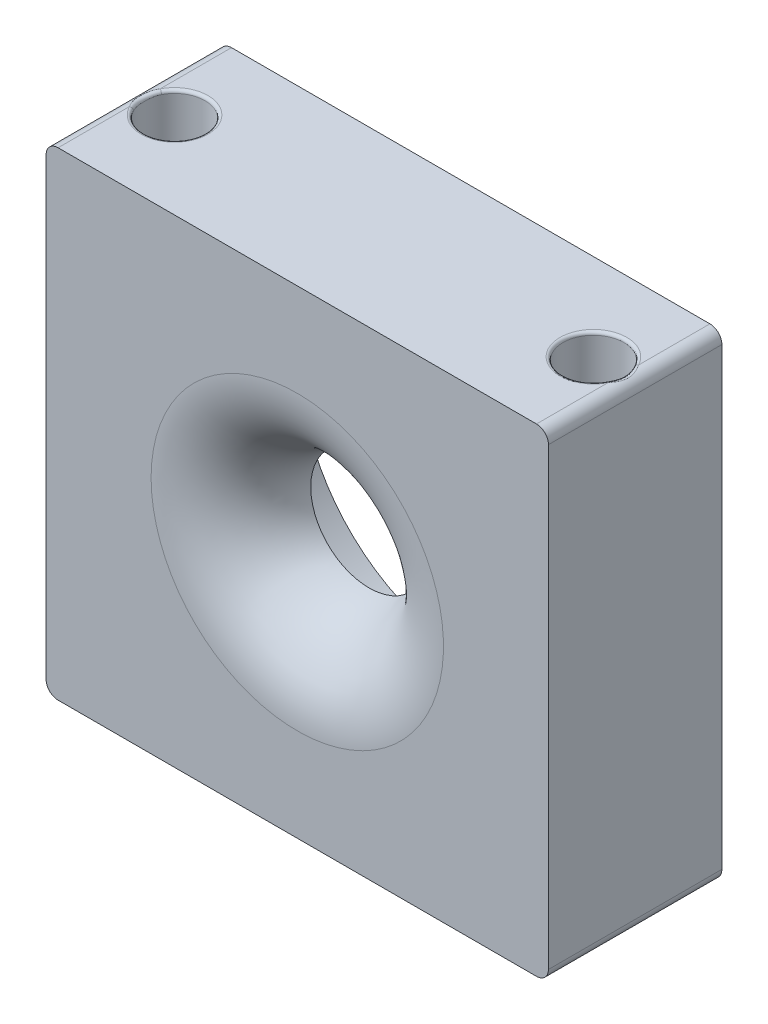
from build123d import *

# Parameters (mm, degrees)
SKETCH1_W          = 80
SKETCH1_H          = 84
SKETCH1_R          = 9.75
MAIN_BOSS_DEPTH    = 29
SKETCH2_R          = 28.5
CUT_EXTRUDE1_DEPTH = 17
FILLET1_R          = 15
SKETCH3_R          = 5.1
SCREW_HEAD_DEPTH   = 38
NUT_START          = -42
NUT_SLOT_DEPTH     = 4.8
SKETCH5_R          = 3.2
THROUGH_HOLE_DEPTH = 62
FILLET2_R          = 3
FILLET3_R          = 2
FILLET4_R          = 0.5


with BuildPart() as part:
    # Sketch1 → Main Boss (new body)
    with BuildSketch(Plane(origin=(0, 0, 0), x_dir=(0, 1, 0), z_dir=(0, 0, 1))):
        Rectangle(SKETCH1_W, SKETCH1_H)
        with Locations(Location((0, 0, 0), (0, 0, 90))):
            Circle(SKETCH1_R, mode=Mode.SUBTRACT)
    extrude(amount=MAIN_BOSS_DEPTH)

    # Sketch2 → Cut-Extrude1 (cut)
    with BuildSketch(Plane(origin=(0, 0, 0), x_dir=(1, 0, 0), z_dir=(0, 0, -1))):
        with Locations(Location((0, 0, 0), (0, 0, 180))):
            Circle(SKETCH2_R)
    extrude(amount=-CUT_EXTRUDE1_DEPTH, mode=Mode.SUBTRACT)

    # Fillet1
    # the kernel refuses this fillet: 15 mm, written as the material it takes off along each edge
    with BuildSketch(Plane(origin=(0, 0, 29), x_dir=(-1, 0, 0), z_dir=(0, 1, 0))) as fillet1_piece_1:
        with BuildLine():
            CenterArc((24.446938457, -15), FILLET1_R, 90, 78.463040967)
            Line((9.75, -12), (9.456061231, -11.94))
            ThreePointArc((9.456061231, -11.94), (9.45, -6), (9.45, 0))
            Line((9.45, 0), (9.75, 0.3))
            Line((9.75, 0.3), (24.446938457, 0.3))
            Line((24.446938457, 0.3), (24.446938457, 0))
        make_face()
    revolve(axis=Axis((0, 0, 29), (0, 0, 1)), mode=Mode.SUBTRACT)

    # Sketch3 → Screw Head (cut)
    with BuildSketch(Plane(origin=(0, 40, 0), x_dir=(-1, 0, 0), z_dir=(0, 1, 0))):
        with Locations((-35.025, 14.5)):
            Circle(SKETCH3_R)
        with Locations((35.025, 14.5)):
            Circle(SKETCH3_R)
    extrude(amount=-SCREW_HEAD_DEPTH, mode=Mode.SUBTRACT)

    # Sketch4 → Nut Slot (cut)
    with BuildSketch(Plane(origin=(0, 40, 0), x_dir=(-1, 0, 0), z_dir=(0, 1, 0)).offset(NUT_START)):
        Polygon((-30.324429276, 17.852307892), (-35.577898433, 20.246967605), (-40.278469158, 16.894659714), (-39.725570724, 11.147692108), (-34.472101567, 8.753032395), (-29.771530842, 12.105340286), align=None)
    nut_slot = extrude(amount=-NUT_SLOT_DEPTH, mode=Mode.SUBTRACT)

    # Sketch5 → Through Hole (cut)
    with BuildSketch(Plane(origin=(0, 40, 0), x_dir=(-1, 0, 0), z_dir=(0, 1, 0))):
        with Locations((-35.025, 14.5)):
            Circle(SKETCH5_R)
    through_hole = extrude(amount=-THROUGH_HOLE_DEPTH, mode=Mode.SUBTRACT)

    # Mirror2: Nut Slot, Through Hole across plane
    add(nut_slot.mirror(Plane(origin=(0, 0, 0), x_dir=(0, 0, 1), z_dir=(1, 0, 0))), mode=Mode.SUBTRACT)
    add(through_hole.mirror(Plane(origin=(0, 0, 0), x_dir=(0, 0, 1), z_dir=(1, 0, 0))), mode=Mode.SUBTRACT)

    # Fillet2
    fillet2_edges = [part.edges().sort_by_distance(p)[0] for p in [
        (28.5, 0, 17),
    ]]
    fillet(fillet2_edges, radius=FILLET2_R)

    # Fillet3
    # the kernel refuses this fillet: 2 mm, written as the material it takes off along each edge
    with BuildSketch(Plane(origin=(42, 40, -5), x_dir=(0, -1, 0), z_dir=(0, 0, 1)), Plane(origin=(-42, 40, -5), x_dir=(1, 0, 0), z_dir=(0, 0, 1))) as fillet3_piece_1:
        with BuildLine():
            CenterArc((FILLET3_R, -FILLET3_R), FILLET3_R, 90, 90)
            Line((0, -FILLET3_R), (0, 0))
            Line((0, 0), (FILLET3_R, 0))
        make_face()
    extrude(amount=39, mode=Mode.SUBTRACT)
    with BuildSketch(Plane(origin=(42, -40, -5), x_dir=(0, 1, 0), z_dir=(0, 0, 1)), Plane(origin=(-42, -40, -5), x_dir=(1, 0, 0), z_dir=(0, 0, 1))) as fillet3_piece_2:
        with BuildLine():
            CenterArc((FILLET3_R, FILLET3_R), FILLET3_R, 180, 90)
            Line((0, FILLET3_R), (0, 0))
            Line((0, 0), (FILLET3_R, 0))
        make_face()
    extrude(amount=39, mode=Mode.SUBTRACT)

    # Fillet4
    fillet4_edges = [part.edges().sort_by_distance(p)[0] for p in [
        (34.46042051, 40, 19.568653667),
        (-40.093653599, 39.997806015, 15.064580313),
        (40.125, 39.996089928, 14.5),
        (-29.925, 40, 14.5),
    ]]
    fillet(fillet4_edges, radius=FILLET4_R)


solid = part.part
